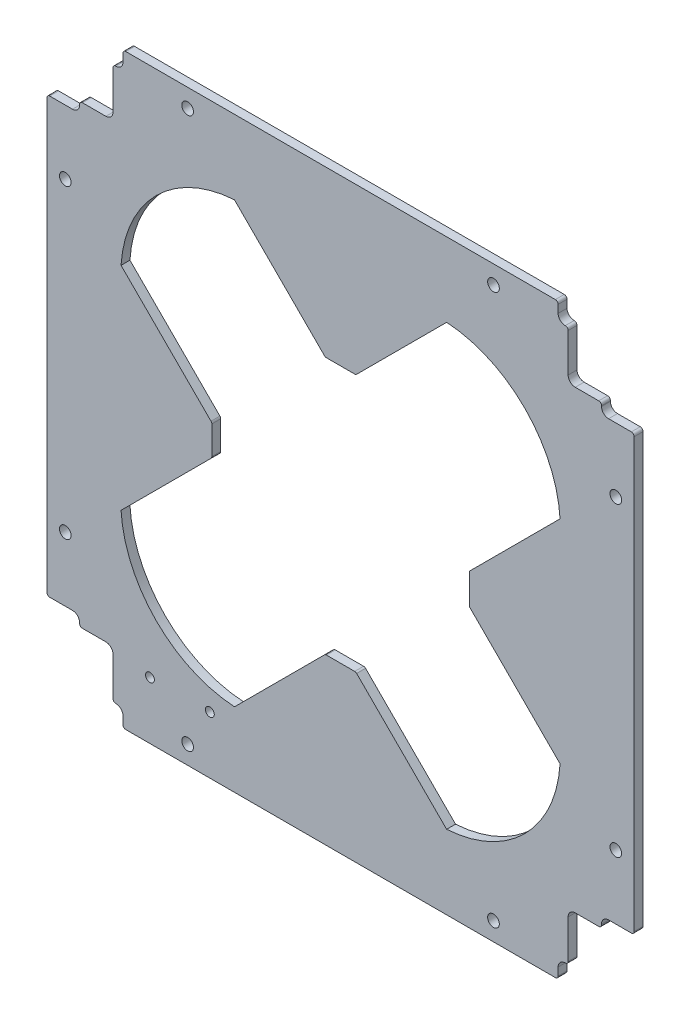
from build123d import *

# Parameters (mm, degrees)
SKETCH1_W                            = 106
SKETCH1_H                            = 106
MAINOUTLINE_DEPTH                    = 1.6
SKETCH4_W                            = 11.7
SKETCH4_H                            = 11.7
RAILCUTOUTS_DEPTH                    = 75.970394157
SKETCH13_W                           = 5.7
SKETCH13_H                           = 1.9
SKETCH13_W_2                         = 1.8
SKETCH13_H_2                         = 3
FILLETCUTOUTS_DEPTH                  = 75.970394157
SMOOTHCORNER_DEPTH                   = 10
MIRROR2_COPY_1_SKETCH_W              = 11.7
MIRROR2_COPY_1_SKETCH_H              = 11.7
MIRROR2_COPY_1_DEPTH                 = 75.970394157
MIRROR2_COPY_2_SKETCH_W              = 5.7
MIRROR2_COPY_2_SKETCH_H              = 1.9
MIRROR2_COPY_2_SKETCH_W_2            = 1.8
MIRROR2_COPY_2_SKETCH_H_2            = 3
MIRROR2_COPY_2_DEPTH                 = 75.970394157
MIRROR2_COPY_3_DEPTH                 = 10
MIRROR2_COPY_4_SKETCH_W              = 11.7
MIRROR2_COPY_4_SKETCH_H              = 11.7
MIRROR2_COPY_4_DEPTH                 = 75.970394157
MIRROR2_COPY_5_SKETCH_W              = 5.7
MIRROR2_COPY_5_SKETCH_H              = 1.9
MIRROR2_COPY_5_SKETCH_W_2            = 1.8
MIRROR2_COPY_5_SKETCH_H_2            = 3
MIRROR2_COPY_5_DEPTH                 = 75.970394157
MIRROR2_COPY_6_DEPTH                 = 10
FILLET10_R                           = 0.5
M2_CLEARANCE_HOLE1_D                 = 2.1
SKETCH15_W                           = 90
SKETCH15_H                           = 5.2
SKETCH15_W_2                         = 5.2
SKETCH15_H_2                         = 90
CUT_EXTRUDE5_DEPTH                   = 0.001
F_1I_CIRCULAR_TURNSTILE_CUTOUT_DEPTH = 10
SKETCH24_OUTSIDE_W                   = 137.984
SKETCH24_OUTSIDE_H                   = 137.984
SKETCH24_OUTSIDE_W_2                 = 105.6
SKETCH24_OUTSIDE_H_2                 = 105.6
CUT_EXTRUDE19_DEPTH                  = 75.970394157
FILLET7_R                            = 0.5
FILLET9_R                            = 2.5
CUT_EXTRUDE21_DEPTH                  = 75.687616109
FILLET11_R                           = 0.5
SKETCH29_R                           = 0.8
CONNECTOR_LOCATOR_HOLES_DEPTH        = 75.687616109


with BuildPart() as part:
    # Sketch1 → mainOutline (new body)
    with BuildSketch(Plane.XY):
        Rectangle(SKETCH1_W, SKETCH1_H)
    extrude(amount=MAINOUTLINE_DEPTH)

    # Sketch4 → railCutouts (cut, through all)
    with BuildSketch(Plane(origin=(0, 0, 0), x_dir=(-1, 0, 0), z_dir=(0, 0, -1))):
        with Locations((47.15, 47.15)):
            Rectangle(SKETCH4_W, SKETCH4_H)
    railcutouts = extrude(amount=-RAILCUTOUTS_DEPTH, mode=Mode.SUBTRACT)

    # Sketch13 → filletCutouts (cut, symmetric)
    with BuildSketch(Plane(origin=(0, 0, 0), x_dir=(-1, 0, 0), z_dir=(0, 0, -1))):
        with Locations((50.15, 40.35)):
            Rectangle(SKETCH13_W, SKETCH13_H)
        with Locations((40.4, 51.5)):
            Rectangle(SKETCH13_W_2, SKETCH13_H_2)
    filletcutouts = extrude(amount=FILLETCUTOUTS_DEPTH, both=True, mode=Mode.SUBTRACT)

    # Sketch27 → smoothCorner (cut)
    with BuildSketch(Plane.XY.offset(1.6)):
        with BuildLine():
            Line((-40.928025612, 42.198025612), (-40.928025612, 49.628025612))
            Line((-40.928025612, 49.628025612), (-40.398025612, 49.628025612))
            ThreePointArc((-40.398025612, 49.628025612), (-39.5, 50), (-39.128025612, 50.898025612))
            Line((-39.128025612, 50.898025612), (-39.128025612, 53))
            Line((-39.128025612, 53), (-53, 53))
            Line((-53, 53), (-53, 39.028025612))
            Line((-53, 39.028025612), (-48.198025612, 39.028025612))
            ThreePointArc((-48.198025612, 39.028025612), (-47.3, 39.4), (-46.928025612, 40.298025612))
            Line((-46.928025612, 40.298025612), (-46.928025612, 40.928025612))
            Line((-46.928025612, 40.928025612), (-42.198025612, 40.928025612))
            ThreePointArc((-42.198025612, 40.928025612), (-41.3, 41.3), (-40.928025612, 42.198025612))
        make_face()
    smoothcorner = extrude(amount=-SMOOTHCORNER_DEPTH, mode=Mode.SUBTRACT)

    # Mirror1: railCutouts, filletCutouts, smoothCorner across plane
    add(railcutouts.mirror(Plane(origin=(0, 0, 0), x_dir=(0, 0, 1), z_dir=(1, 0, 0))), mode=Mode.SUBTRACT)
    add(filletcutouts.mirror(Plane(origin=(0, 0, 0), x_dir=(0, 0, 1), z_dir=(1, 0, 0))), mode=Mode.SUBTRACT)
    add(smoothcorner.mirror(Plane(origin=(0, 0, 0), x_dir=(0, 0, 1), z_dir=(1, 0, 0))), mode=Mode.SUBTRACT)

    # Mirror2 copy 1 sketch → Mirror2 copy 1 (cut, through all)
    with BuildSketch(Plane(origin=(0, 0, 0), x_dir=(1, 0, 0), z_dir=(0, 0, -1))):
        with Locations((47.15, 47.15)):
            Rectangle(MIRROR2_COPY_1_SKETCH_W, MIRROR2_COPY_1_SKETCH_H)
    extrude(amount=-MIRROR2_COPY_1_DEPTH, mode=Mode.SUBTRACT)

    # Mirror2 copy 2 sketch → Mirror2 copy 2 (cut, symmetric)
    with BuildSketch(Plane(origin=(0, 0, 0), x_dir=(1, 0, 0), z_dir=(0, 0, -1))):
        with Locations((50.15, 40.35)):
            Rectangle(MIRROR2_COPY_2_SKETCH_W, MIRROR2_COPY_2_SKETCH_H)
        with Locations((40.4, 51.5)):
            Rectangle(MIRROR2_COPY_2_SKETCH_W_2, MIRROR2_COPY_2_SKETCH_H_2)
    extrude(amount=MIRROR2_COPY_2_DEPTH, both=True, mode=Mode.SUBTRACT)

    # Mirror2 copy 3 sketch → Mirror2 copy 3 (cut)
    with BuildSketch(Plane(origin=(0, 0, 1.6), x_dir=(-1, 0, 0), z_dir=(0, 0, 1))):
        with BuildLine():
            Line((-40.928025612, 42.198025612), (-40.928025612, 49.628025612))
            Line((-40.928025612, 49.628025612), (-40.398025612, 49.628025612))
            ThreePointArc((-40.398025612, 49.628025612), (-39.5, 50), (-39.128025612, 50.898025612))
            Line((-39.128025612, 50.898025612), (-39.128025612, 53))
            Line((-39.128025612, 53), (-53, 53))
            Line((-53, 53), (-53, 39.028025612))
            Line((-53, 39.028025612), (-48.198025612, 39.028025612))
            ThreePointArc((-48.198025612, 39.028025612), (-47.3, 39.4), (-46.928025612, 40.298025612))
            Line((-46.928025612, 40.298025612), (-46.928025612, 40.928025612))
            Line((-46.928025612, 40.928025612), (-42.198025612, 40.928025612))
            ThreePointArc((-42.198025612, 40.928025612), (-41.3, 41.3), (-40.928025612, 42.198025612))
        make_face()
    extrude(amount=-MIRROR2_COPY_3_DEPTH, mode=Mode.SUBTRACT)

    # Mirror2 copy 4 sketch → Mirror2 copy 4 (cut, through all)
    with BuildSketch(Plane(origin=(0, 0, 0), x_dir=(-1, 0, 0), z_dir=(0, 0, -1))):
        with Locations((47.15, -47.15)):
            Rectangle(MIRROR2_COPY_4_SKETCH_W, MIRROR2_COPY_4_SKETCH_H)
    extrude(amount=-MIRROR2_COPY_4_DEPTH, mode=Mode.SUBTRACT)

    # Mirror2 copy 5 sketch → Mirror2 copy 5 (cut, symmetric)
    with BuildSketch(Plane(origin=(0, 0, 0), x_dir=(-1, 0, 0), z_dir=(0, 0, -1))):
        with Locations((50.15, -40.35)):
            Rectangle(MIRROR2_COPY_5_SKETCH_W, MIRROR2_COPY_5_SKETCH_H)
        with Locations((40.4, -51.5)):
            Rectangle(MIRROR2_COPY_5_SKETCH_W_2, MIRROR2_COPY_5_SKETCH_H_2)
    extrude(amount=MIRROR2_COPY_5_DEPTH, both=True, mode=Mode.SUBTRACT)

    # Mirror2 copy 6 sketch → Mirror2 copy 6 (cut)
    with BuildSketch(Plane.XY.offset(1.6)):
        with BuildLine():
            Line((-40.928025612, -42.198025612), (-40.928025612, -49.628025612))
            Line((-40.928025612, -49.628025612), (-40.398025612, -49.628025612))
            ThreePointArc((-40.398025612, -49.628025612), (-39.5, -50), (-39.128025612, -50.898025612))
            Line((-39.128025612, -50.898025612), (-39.128025612, -53))
            Line((-39.128025612, -53), (-53, -53))
            Line((-53, -53), (-53, -39.028025612))
            Line((-53, -39.028025612), (-48.198025612, -39.028025612))
            ThreePointArc((-48.198025612, -39.028025612), (-47.3, -39.4), (-46.928025612, -40.298025612))
            Line((-46.928025612, -40.298025612), (-46.928025612, -40.928025612))
            Line((-46.928025612, -40.928025612), (-42.198025612, -40.928025612))
            ThreePointArc((-42.198025612, -40.928025612), (-41.3, -41.3), (-40.928025612, -42.198025612))
        make_face()
    extrude(amount=-MIRROR2_COPY_6_DEPTH, mode=Mode.SUBTRACT)

    # Fillet10
    fillet10_edges = [part.edges().sort_by_distance(p)[0] for p in [
        (46.928025612, -40.928025612, 0.8),
        (40.928025612, -49.628025612, 0.8),
        (40.928025612, 49.628025612, 0.8),
        (46.928025612, 40.928025612, 0.8),
        (-46.928025612, 40.928025612, 0.8),
        (-40.928025612, 49.628025612, 0.8),
        (-46.928025612, -40.928025612, 0.8),
        (-40.928025612, -49.628025612, 0.8),
    ]]
    fillet(fillet10_edges, radius=FILLET10_R)

    # M2 Clearance Hole1 (through all)
    with Locations(Plane(origin=(0, 0, 0), x_dir=(-1, 0, 0), z_dir=(0, 0, -1))):
        with Locations((49.5, -27.5), (27.5, -49.5), (-49.5, -27.5), (-27.5, -49.5), (-27.5, 49.5), (-49.5, 27.5), (27.5, 49.5), (49.5, 27.5)):
            Hole(M2_CLEARANCE_HOLE1_D / 2)

    # Sketch15 → Cut-Extrude5 (cut)
    with BuildSketch(Plane(origin=(0, 0, 0), x_dir=(-1, 0, 0), z_dir=(0, 0, -1))):
        with Locations((0, 50.4)):
            Rectangle(SKETCH15_W, SKETCH15_H)
        with Locations((0, -50.4)):
            Rectangle(SKETCH15_W, SKETCH15_H)
        with Locations((-50.4, 0)):
            Rectangle(SKETCH15_W_2, SKETCH15_H_2)
        with Locations((50.4, 0)):
            Rectangle(SKETCH15_W_2, SKETCH15_H_2)
    extrude(amount=-CUT_EXTRUDE5_DEPTH, mode=Mode.SUBTRACT)

    # Sketch26 → 1I circular turnstile cutout (cut)
    with BuildSketch(Plane.XY.offset(1.6)):
        with BuildLine():
            Line((0, 19.127238431), (19.712829338, 38.840067769))
            ThreePointArc((19.712829338, 38.840067769), (33.132146638, 33.132146638), (38.840067769, 19.712829338))
            Line((38.840067769, 19.712829338), (19.127238431, 0))
            Line((19.127238431, 0), (38.840067769, -19.712829338))
            ThreePointArc((38.840067769, -19.712829338), (33.132146638, -33.132146638), (19.712829338, -38.840067769))
            Line((19.712829338, -38.840067769), (0, -19.127238431))
            Line((0, -19.127238431), (-19.712829338, -38.840067769))
            ThreePointArc((-19.712829338, -38.840067769), (-33.132146638, -33.132146638), (-38.840067769, -19.712829338))
            Line((-38.840067769, -19.712829338), (-19.127238431, 0))
            Line((-19.127238431, 0), (-38.840067769, 19.712829338))
            ThreePointArc((-38.840067769, 19.712829338), (-33.132146638, 33.132146638), (-19.712829338, 38.840067769))
            Line((-19.712829338, 38.840067769), (0, 19.127238431))
        make_face()
    extrude(amount=-F_1I_CIRCULAR_TURNSTILE_CUTOUT_DEPTH, mode=Mode.SUBTRACT)

    # Sketch24 outside → Cut-Extrude19 (cut, through all)
    with BuildSketch(Plane.XY.offset(1.6)):
        Rectangle(SKETCH24_OUTSIDE_W, SKETCH24_OUTSIDE_H)
        Rectangle(SKETCH24_OUTSIDE_W_2, SKETCH24_OUTSIDE_H_2, mode=Mode.SUBTRACT)
    extrude(amount=-CUT_EXTRUDE19_DEPTH, mode=Mode.SUBTRACT)

    # Fillet7
    fillet7_edges = [part.edges().sort_by_distance(p)[0] for p in [
        (-52.8, -39.028025612, 0.8005),
        (-39.128025612, -52.8, 0.8005),
        (39.128025612, -52.8, 0.8005),
        (52.8, -39.028025612, 0.8005),
        (52.8, 39.028025612, 0.8005),
        (39.128025612, 52.8, 0.8005),
        (-39.128025612, 52.8, 0.8005),
        (-52.8, 39.028025612, 0.8005),
    ]]
    fillet(fillet7_edges, radius=FILLET7_R)

    # Fillet9
    fillet9_edges = [part.edges().sort_by_distance(p)[0] for p in [
        (0, -19.127238431, 0.8),
        (-19.127238431, 0, 0.8),
        (19.127238431, 0, 0.8),
        (0, 19.127238431, 0.8),
    ]]
    fillet(fillet9_edges, radius=FILLET9_R)

    # Sketch28 → Cut-Extrude21 (cut, through all)
    with BuildSketch(Plane.XY.offset(1.6)):
        with BuildLine():
            Line((-2.75, -23.150030637), (2.75, -23.150030637))
            Line((2.75, -23.150030637), (19.076433235, -39.476463872))
            ThreePointArc((19.076433235, -39.476463872), (33.132146638, -33.132146638), (39.476463872, -19.076433235))
            Line((39.476463872, -19.076433235), (23.150030637, -2.75))
            Line((23.150030637, -2.75), (23.150030637, 2.75))
            Line((23.150030637, 2.75), (39.476463872, 19.076433235))
            ThreePointArc((39.476463872, 19.076433235), (33.132146638, 33.132146638), (19.076433235, 39.476463872))
            Line((19.076433235, 39.476463872), (2.75, 23.150030637))
            Line((2.75, 23.150030637), (-2.75, 23.150030637))
            Line((-2.75, 23.150030637), (-19.076433235, 39.476463872))
            ThreePointArc((-19.076433235, 39.476463872), (-33.132146638, 33.132146638), (-39.476463872, 19.076433235))
            Line((-39.476463872, 19.076433235), (-23.150030637, 2.75))
            Line((-23.150030637, 2.75), (-23.150030637, -2.75))
            Line((-23.150030637, -2.75), (-39.476463872, -19.076433235))
            ThreePointArc((-39.476463872, -19.076433235), (-33.132146638, -33.132146638), (-19.076433235, -39.476463872))
            Line((-19.076433235, -39.476463872), (-2.75, -23.150030637))
        make_face()
    extrude(amount=-CUT_EXTRUDE21_DEPTH, mode=Mode.SUBTRACT)

    # Fillet11
    fillet11_edges = [part.edges().sort_by_distance(p)[0] for p in [
        (23.150030637, 2.75, 0.8),
        (23.150030637, -2.75, 0.8),
        (2.75, 23.150030637, 0.8),
        (-2.75, 23.150030637, 0.8),
        (-23.150030637, 2.75, 0.8),
        (-23.150030637, -2.75, 0.8),
        (-2.75, -23.150030637, 0.8),
        (2.75, -23.150030637, 0.8),
    ]]
    fillet(fillet11_edges, radius=FILLET11_R)

    # Sketch29 → Connector locator holes (cut, through all)
    with BuildSketch(Plane.XY.offset(1.6)):
        with Locations((-34.28, -42.5)):
            Circle(SKETCH29_R)
        with Locations((-23.51, -42.5)):
            Circle(SKETCH29_R)
    extrude(amount=-CONNECTOR_LOCATOR_HOLES_DEPTH, mode=Mode.SUBTRACT)


solid = part.part
